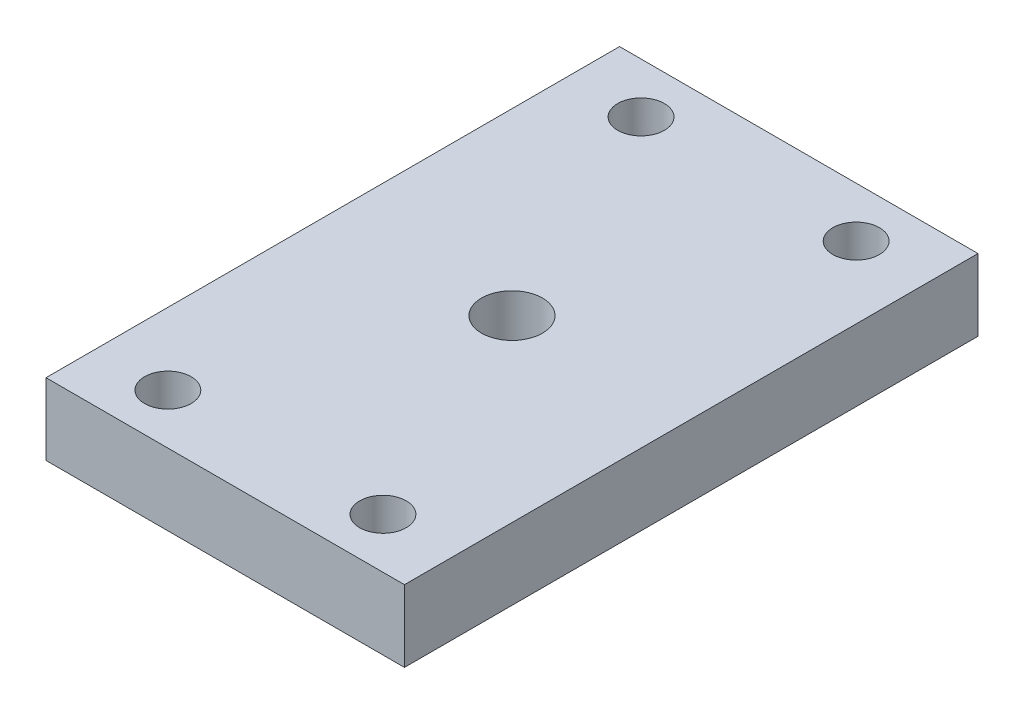
from build123d import *

# Parameters (mm, degrees)
SKETCH1_W           = 50
SKETCH1_H           = 80
BOSS_EXTRUDE1_DEPTH = 10
CUT_EXTRUDE1_REACH  = 58.912
SKETCH2_R           = 4.25
CUT_EXTRUDE3_REACH  = 58.912
SKETCH5_R           = 3.25


with BuildPart() as part:
    # Sketch1 → Boss-Extrude1 (new body)
    with BuildSketch(Plane(origin=(0, 0, 0), x_dir=(1, 0, 0), z_dir=(0, 1, 0))):
        with Locations((5.890258642, -6.741379093)):
            Rectangle(SKETCH1_W, SKETCH1_H)
    extrude(amount=BOSS_EXTRUDE1_DEPTH)

    # Sketch2 → Cut-Extrude1 (cut, up to next)
    with BuildSketch(Plane.XZ, mode=Mode.PRIVATE) as cut_extrude1_sk1:
        with Locations((5.890258642, 6.741379093)):
            Circle(SKETCH2_R)
    cut_extrude1_tool1 = extrude(cut_extrude1_sk1.sketch, amount=-CUT_EXTRUDE1_REACH, mode=Mode.PRIVATE) & part.part
    add(cut_extrude1_tool1.solids().sort_by_distance((5.890259, 0, 6.741379))[0], mode=Mode.SUBTRACT)

    # Sketch5 → Cut-Extrude3 (cut, up to next)
    with BuildSketch(Plane(origin=(0, 10, 0), x_dir=(1, 0, 0), z_dir=(0, 1, 0)), mode=Mode.PRIVATE) as cut_extrude3_sk1:
        with Locations((-9.109741358, -39.741379093)):
            Circle(SKETCH5_R)
    cut_extrude3_tool1 = extrude(cut_extrude3_sk1.sketch, amount=-CUT_EXTRUDE3_REACH, mode=Mode.PRIVATE) & part.part
    # Sketch5 → Cut-Extrude3 (cut, up to next)
    with BuildSketch(Plane(origin=(0, 10, 0), x_dir=(1, 0, 0), z_dir=(0, 1, 0)), mode=Mode.PRIVATE) as cut_extrude3_sk2:
        with Locations((20.890258642, -39.741379093)):
            Circle(SKETCH5_R)
    cut_extrude3_tool2 = extrude(cut_extrude3_sk2.sketch, amount=-CUT_EXTRUDE3_REACH, mode=Mode.PRIVATE) & part.part
    # Sketch5 → Cut-Extrude3 (cut, up to next)
    with BuildSketch(Plane(origin=(0, 10, 0), x_dir=(1, 0, 0), z_dir=(0, 1, 0)), mode=Mode.PRIVATE) as cut_extrude3_sk3:
        with Locations((-9.109741358, 26.258620907)):
            Circle(SKETCH5_R)
    cut_extrude3_tool3 = extrude(cut_extrude3_sk3.sketch, amount=-CUT_EXTRUDE3_REACH, mode=Mode.PRIVATE) & part.part
    # Sketch5 → Cut-Extrude3 (cut, up to next)
    with BuildSketch(Plane(origin=(0, 10, 0), x_dir=(1, 0, 0), z_dir=(0, 1, 0)), mode=Mode.PRIVATE) as cut_extrude3_sk4:
        with Locations((20.890258642, 26.258620907)):
            Circle(SKETCH5_R)
    cut_extrude3_tool4 = extrude(cut_extrude3_sk4.sketch, amount=-CUT_EXTRUDE3_REACH, mode=Mode.PRIVATE) & part.part
    add(cut_extrude3_tool1.solids().sort_by_distance((-9.109741, 10, 39.741379))[0], mode=Mode.SUBTRACT)
    add(cut_extrude3_tool2.solids().sort_by_distance((20.890259, 10, 39.741379))[0], mode=Mode.SUBTRACT)
    add(cut_extrude3_tool3.solids().sort_by_distance((-9.109741, 10, -26.258621))[0], mode=Mode.SUBTRACT)
    add(cut_extrude3_tool4.solids().sort_by_distance((20.890259, 10, -26.258621))[0], mode=Mode.SUBTRACT)


solid = part.part
